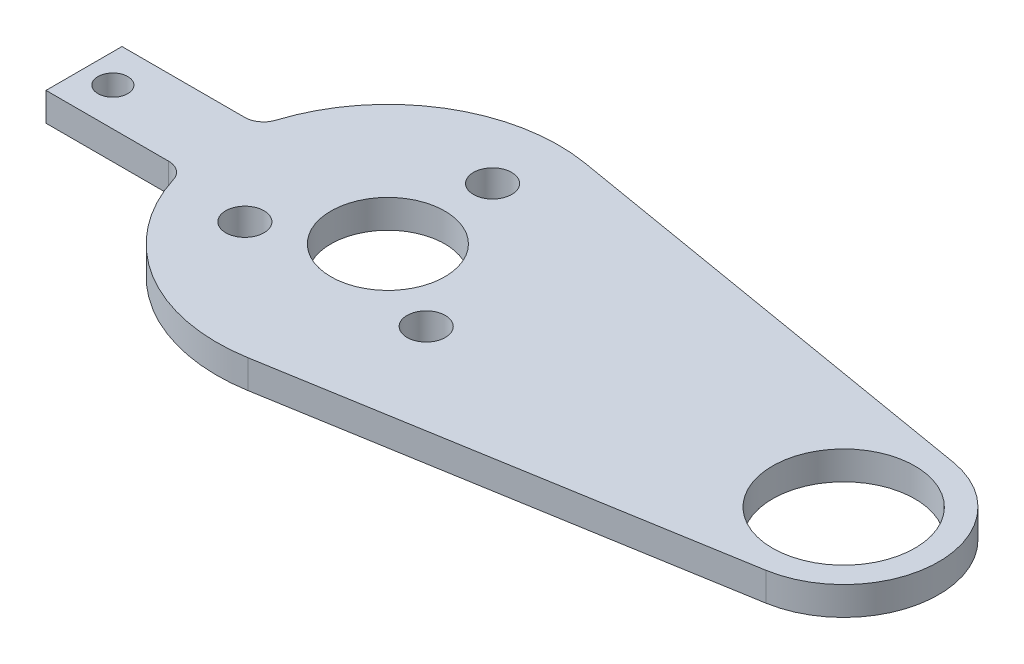
from build123d import *

# Parameters (mm, degrees)
BOSS_EXTRUDE1_DEPTH        = 4.7625
SKETCH2_R                  = 11.90625
CUT_EXTRUDE1_DEPTH         = 97.524699721
M6_CLEARANCE_HOLE1_D       = 6.4
SKETCH5_R                  = 9.525
CUT_EXTRUDE2_DEPTH         = 97.524699721
FILLET1_R                  = 3.175
F_10_CLEARANCE_HOLE1_D     = 4.9784
F_10_CLEARANCE_HOLE1_DEPTH = 9.525
F_10_CLEARANCE_HOLE1_TIP   = 1.495662253


with BuildPart() as part:
    # Sketch1 → Boss-Extrude1 (new body)
    with BuildSketch(Plane(origin=(0, 0, 0), x_dir=(1, 0, 0), z_dir=(0, 1, 0))):
        with BuildLine():
            Line((4.7625, 28.175329967), (78.845833333, 15.652961093))
            ThreePointArc((78.845833333, 15.652961093), (92.075, 0), (78.845833333, -15.652961093))
            Line((78.845833333, -15.652961093), (4.7625, -28.175329967))
            ThreePointArc((4.7625, -28.175329967), (-15.889172282, -23.750049035), (-27.86051193, -6.35))
            Line((-27.86051193, -6.35), (-50.8, -6.35))
            Line((-50.8, -6.35), (-50.8, 6.35))
            Line((-50.8, 6.35), (-27.86051193, 6.35))
            ThreePointArc((-27.86051193, 6.35), (-15.889172282, 23.750049035), (4.7625, 28.175329967))
        make_face()
    extrude(amount=BOSS_EXTRUDE1_DEPTH)

    # Sketch2 → Cut-Extrude1 (cut, through all)
    with BuildSketch(Plane(origin=(0, 4.7625, 0), x_dir=(1, 0, 0), z_dir=(0, 1, 0))):
        with Locations((76.2, 0)):
            Circle(SKETCH2_R)
    extrude(amount=-CUT_EXTRUDE1_DEPTH, mode=Mode.SUBTRACT)

    # M6 Clearance Hole1 (through all)
    with Locations(Plane(origin=(0, 4.7625, -17.5), x_dir=(0, 0, 1), z_dir=(0, 1, 0))):
        with Locations((0, 0), (26.25, -15.155444566), (26.25, 15.155444566)):
            Hole(M6_CLEARANCE_HOLE1_D / 2)

    # Sketch5 → Cut-Extrude2 (cut, through all)
    with BuildSketch(Plane(origin=(0, 4.7625, 0), x_dir=(1, 0, 0), z_dir=(0, 1, 0))):
        Circle(SKETCH5_R)
    extrude(amount=-CUT_EXTRUDE2_DEPTH, mode=Mode.SUBTRACT)

    # Fillet1
    fillet1_edges = [part.edges().sort_by_distance(p)[0] for p in [
        (-27.86051193, 2.38125, 6.35),
        (-27.86051193, 2.38125, -6.35),
    ]]
    fillet(fillet1_edges, radius=FILLET1_R)

    # #10 Clearance Hole1
    with Locations(Plane(origin=(-45.974, 4.7625, 0), x_dir=(0, 0, 1), z_dir=(0, 1, 0))):
        with Locations((0, 0)):
            Hole(F_10_CLEARANCE_HOLE1_D / 2, depth=F_10_CLEARANCE_HOLE1_DEPTH)
            with Locations((0, 0, -(F_10_CLEARANCE_HOLE1_DEPTH + F_10_CLEARANCE_HOLE1_TIP / 2))):  # 118° drill point
                Cone(0, F_10_CLEARANCE_HOLE1_D / 2, F_10_CLEARANCE_HOLE1_TIP, mode=Mode.SUBTRACT)


solid = part.part
